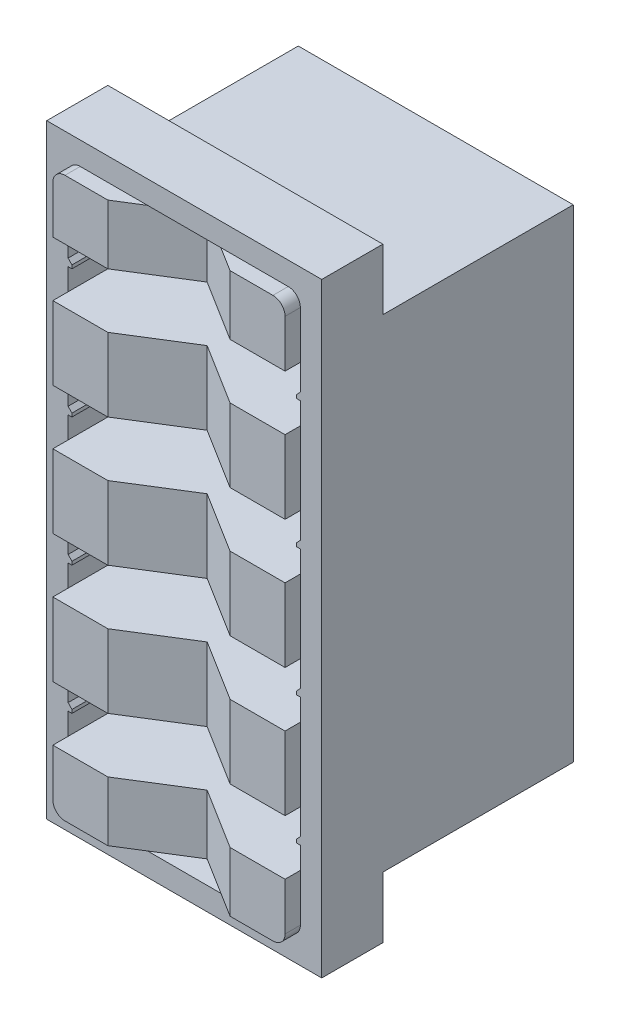
from build123d import *

# Parameters (mm, degrees)
SKETCH1_W              = 36
SKETCH1_H              = 79.20150733
BOSS_EXTRUDE1_DEPTH    = 33.93
CUT_EXTRUDE1_REACH     = 65.368
SKETCH2_W              = 23.93
SKETCH2_H              = 8
SKETCH3_W              = 30.4
SKETCH3_H              = 7.2
CUT_EXTRUDE2_DEPTH     = 31.93
CUT_EXTRUDE3_START     = -3
CUT_EXTRUDE3_DEPTH     = 73.2
CUT_EXTRUDE4_REACH     = 55.961
BOSS_EXTRUDE2_REACH    = 57.168
LPATTERN1_COUNT        = 4
LPATTERN1_PITCH        = 16.8
LPATTERN1_COPY_1_REACH = 57.168
LPATTERN1_COPY_2_REACH = 57.168
LPATTERN1_COPY_3_REACH = 57.168
SKETCH7_W              = 36
SKETCH7_H              = 79.20150733
CUT_EXTRUDE5_DEPTH     = 2
FILLET1_R              = 1.5875
MOVE_START             = -34.93
MOVE_FACE1_OUTLINE_W   = 36
MOVE_FACE1_OUTLINE_H   = 63.20150733
MOVE_FACE1_DEPTH       = 1


# Read off the part's stored shape, not the designer's step: Move Face1
with BuildPart() as part:
    # Sketch1 → Boss-Extrude1 (new body)
    with BuildSketch(Plane.XY):
        Rectangle(SKETCH1_W, SKETCH1_H)
    extrude(amount=-BOSS_EXTRUDE1_DEPTH)

    # Sketch2 → Cut-Extrude1 (cut, up to next)
    with BuildSketch(Plane(origin=(18, 0, 0), x_dir=(0, 0, -1), z_dir=(1, 0, 0)), mode=Mode.PRIVATE) as cut_extrude1_sk1:
        with Locations((21.965, 35.600753665)):
            Rectangle(SKETCH2_W, SKETCH2_H)
    cut_extrude1_tool1 = extrude(cut_extrude1_sk1.sketch, amount=-CUT_EXTRUDE1_REACH, mode=Mode.PRIVATE) & part.part
    # Sketch2 → Cut-Extrude1 (cut, up to next)
    with BuildSketch(Plane(origin=(18, 0, 0), x_dir=(0, 0, -1), z_dir=(1, 0, 0)), mode=Mode.PRIVATE) as cut_extrude1_sk2:
        with Locations((21.965, -35.600753665)):
            Rectangle(SKETCH2_W, SKETCH2_H)
    cut_extrude1_tool2 = extrude(cut_extrude1_sk2.sketch, amount=-CUT_EXTRUDE1_REACH, mode=Mode.PRIVATE) & part.part
    add(cut_extrude1_tool1.solids().sort_by_distance((18, 35.600754, -21.965))[0], mode=Mode.SUBTRACT)
    add(cut_extrude1_tool2.solids().sort_by_distance((18, -35.600754, -21.965))[0], mode=Mode.SUBTRACT)

    # Sketch3 → Cut-Extrude2 (cut)
    with BuildSketch(Plane.XY):
        with Locations((0, 8.400251222)):
            Rectangle(SKETCH3_W, SKETCH3_H)
        with Locations((0, 25.200753665)):
            Rectangle(SKETCH3_W, SKETCH3_H)
        with Locations((0, -8.400251222)):
            Rectangle(SKETCH3_W, SKETCH3_H)
        with Locations((0, -25.200753665)):
            Rectangle(SKETCH3_W, SKETCH3_H)
    extrude(amount=-CUT_EXTRUDE2_DEPTH, mode=Mode.SUBTRACT)

    # Sketch4 → Cut-Extrude3 (cut)
    with BuildSketch(Plane(origin=(0, 39.600753665, 0), x_dir=(1, 0, 0), z_dir=(0, 1, 0)).offset(CUT_EXTRUDE3_START)):
        Polygon((-8, 0), (0, 5), (8, 0), align=None)
    extrude(amount=-CUT_EXTRUDE3_DEPTH, mode=Mode.SUBTRACT)

    # Sketch5 → Cut-Extrude4 (cut, up to next)
    with BuildSketch(Plane.XY.offset(-31.93), mode=Mode.PRIVATE) as cut_extrude4_sk1:
        with BuildLine():
            Line((-2.89, 26.780753665), (2.89, 26.780753665))
            ThreePointArc((2.89, 26.780753665), (4.47, 25.200753665), (2.89, 23.620753665))
            Line((2.89, 23.620753665), (-2.89, 23.620753665))
            ThreePointArc((-2.89, 23.620753665), (-4.47, 25.200753665), (-2.89, 26.780753665))
        make_face()
    cut_extrude4_tool1 = extrude(cut_extrude4_sk1.sketch, amount=-CUT_EXTRUDE4_REACH, mode=Mode.PRIVATE) & part.part
    cut_extrude4 = cut_extrude4_tool1.solids().sort_by_distance((0, 25.200754, -31.93))[0]
    add(cut_extrude4, mode=Mode.SUBTRACT)

    # Sketch6 → Boss-Extrude2 (add, up to next)
    with BuildSketch(Plane.XY, mode=Mode.PRIVATE) as boss_extrude2_sk1:
        Polygon((-15.2, 25.423123011), (-15.2, 24.450753665), (-14.7, 24.450753665), (-14.7, 24.896968819), align=None)
    boss_extrude2_tool1 = extrude(boss_extrude2_sk1.sketch, amount=-BOSS_EXTRUDE2_REACH, mode=Mode.PRIVATE) - part.part
    boss_extrude2 = boss_extrude2_tool1.solids().sort_by_distance((-14.980908, 24.821662, 0))[0]
    add(boss_extrude2)

    # Mirror1: Boss-Extrude2 across plane
    add(boss_extrude2.mirror(Plane(origin=(0, 0, 0), x_dir=(0, 0, 1), z_dir=(1, 0, 0))))

    # LPattern1: Cut-Extrude4, Boss-Extrude2 ×4
    with Locations(*[(0, -i * LPATTERN1_PITCH, 0) for i in range(1, LPATTERN1_COUNT)]):
        add(cut_extrude4, mode=Mode.SUBTRACT)
        add(boss_extrude2)

    # LPattern1 copy 1 sketch → LPattern1 copy 1 (add, up to next)
    with BuildSketch(Plane(origin=(0, -16.8, 0), x_dir=(-1, 0, 0), z_dir=(0, 0, 1)), mode=Mode.PRIVATE) as lpattern1_copy_1_sk1:
        Polygon((-15.2, -25.423123011), (-15.2, -24.450753665), (-14.7, -24.450753665), (-14.7, -24.896968819), align=None)
    lpattern1_copy_1_tool1 = extrude(lpattern1_copy_1_sk1.sketch, amount=-LPATTERN1_COPY_1_REACH, mode=Mode.PRIVATE) - part.part
    add(lpattern1_copy_1_tool1.solids().sort_by_distance((14.980908, 8.021662, 0))[0])

    # LPattern1 copy 2 sketch → LPattern1 copy 2 (add, up to next)
    with BuildSketch(Plane(origin=(0, -33.6, 0), x_dir=(-1, 0, 0), z_dir=(0, 0, 1)), mode=Mode.PRIVATE) as lpattern1_copy_2_sk1:
        Polygon((-15.2, -25.423123011), (-15.2, -24.450753665), (-14.7, -24.450753665), (-14.7, -24.896968819), align=None)
    lpattern1_copy_2_tool1 = extrude(lpattern1_copy_2_sk1.sketch, amount=-LPATTERN1_COPY_2_REACH, mode=Mode.PRIVATE) - part.part
    add(lpattern1_copy_2_tool1.solids().sort_by_distance((14.980908, -8.778338, 0))[0])

    # LPattern1 copy 3 sketch → LPattern1 copy 3 (add, up to next)
    with BuildSketch(Plane(origin=(0, -50.4, 0), x_dir=(-1, 0, 0), z_dir=(0, 0, 1)), mode=Mode.PRIVATE) as lpattern1_copy_3_sk1:
        Polygon((-15.2, -25.423123011), (-15.2, -24.450753665), (-14.7, -24.450753665), (-14.7, -24.896968819), align=None)
    lpattern1_copy_3_tool1 = extrude(lpattern1_copy_3_sk1.sketch, amount=-LPATTERN1_COPY_3_REACH, mode=Mode.PRIVATE) - part.part
    add(lpattern1_copy_3_tool1.solids().sort_by_distance((14.980908, -25.578338, 0))[0])

    # Sketch7 → Cut-Extrude5 (cut)
    with BuildSketch(Plane.XY):
        Rectangle(SKETCH7_W, SKETCH7_H)
        Polygon((-15.2, -36.599246335), (15.2, -36.599246335), (15.2, -25.949246335), (14.7, -25.949246335), (14.7, -25.503031181), (15.2, -24.976876989), (15.2, -9.149246335), (14.7, -9.149246335), (14.7, -8.703031181), (15.2, -8.176876989), (15.2, 7.650753665), (14.7, 7.650753665), (14.7, 8.096968819), (15.2, 8.623123011), (15.2, 24.450753665), (14.7, 24.450753665), (14.7, 24.896968819), (15.2, 25.423123011), (15.2, 36.600753665), (-15.2, 36.600753665), (-15.2, 25.423123011), (-14.7, 24.896968819), (-14.7, 24.450753665), (-15.2, 24.450753665), (-15.2, 8.623123011), (-14.7, 8.096968819), (-14.7, 7.650753665), (-15.2, 7.650753665), (-15.2, -8.176876989), (-14.7, -8.703031181), (-14.7, -9.149246335), (-15.2, -9.149246335), (-15.2, -24.976876989), (-14.7, -25.503031181), (-14.7, -25.949246335), (-15.2, -25.949246335), align=None, mode=Mode.SUBTRACT)
    extrude(amount=-CUT_EXTRUDE5_DEPTH, mode=Mode.SUBTRACT)

    # Fillet1
    fillet1_edges = [part.edges().sort_by_distance(p)[0] for p in [
        (15.2, 36.600753665, -1),
        (-15.2, -36.599246335, -1),
        (-15.2, 36.600753665, -1),
        (15.2, -36.599246335, -1),
    ]]
    fillet(fillet1_edges, radius=FILLET1_R)

    # Move Face1 outline → Move Face1 (add)
    with BuildSketch(Plane.XY.offset(MOVE_START)):
        Rectangle(MOVE_FACE1_OUTLINE_W, MOVE_FACE1_OUTLINE_H)
        with BuildLine():
            ThreePointArc((-2.89, -26.779246335), (-4.47, -25.199246335), (-2.89, -23.619246335))
            Line((-2.89, -23.619246335), (2.89, -23.619246335))
            ThreePointArc((2.89, -23.619246335), (4.47, -25.199246335), (2.89, -26.779246335))
            Line((2.89, -26.779246335), (-2.89, -26.779246335))
        make_face(mode=Mode.SUBTRACT)
        with BuildLine():
            ThreePointArc((-2.89, -9.979246335), (-4.47, -8.399246335), (-2.89, -6.819246335))
            Line((-2.89, -6.819246335), (2.89, -6.819246335))
            ThreePointArc((2.89, -6.819246335), (4.47, -8.399246335), (2.89, -9.979246335))
            Line((2.89, -9.979246335), (-2.89, -9.979246335))
        make_face(mode=Mode.SUBTRACT)
        with BuildLine():
            ThreePointArc((-2.89, 6.820753665), (-4.47, 8.400753665), (-2.89, 9.980753665))
            Line((-2.89, 9.980753665), (2.89, 9.980753665))
            ThreePointArc((2.89, 9.980753665), (4.47, 8.400753665), (2.89, 6.820753665))
            Line((2.89, 6.820753665), (-2.89, 6.820753665))
        make_face(mode=Mode.SUBTRACT)
        with BuildLine():
            ThreePointArc((-2.89, 23.620753665), (-4.47, 25.200753665), (-2.89, 26.780753665))
            Line((-2.89, 26.780753665), (2.89, 26.780753665))
            ThreePointArc((2.89, 26.780753665), (4.47, 25.200753665), (2.89, 23.620753665))
            Line((2.89, 23.620753665), (-2.89, 23.620753665))
        make_face(mode=Mode.SUBTRACT)
    extrude(amount=MOVE_FACE1_DEPTH)


solid = part.part
